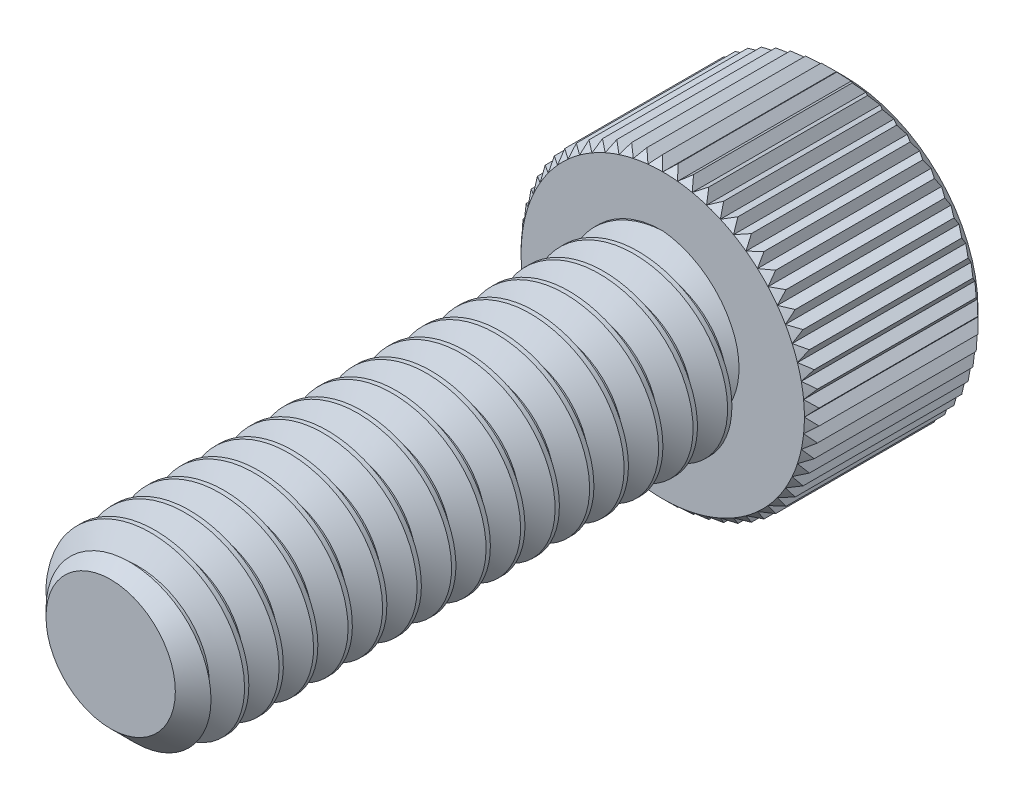
from build123d import *
from build123d.topology import SkipClean

# Parameters (mm, degrees)
SKETCH1_R          = 2.0828
EXTRUDE1_DEPTH     = 12.7
CHAMFER3_SIZE      = 0.5953125
CUT_SWEEP1_PITCH   = 0.79375
SKETCH6_R          = 3.429
EXTRUDE2_DEPTH     = 4.1656
CUT_EXTRUDE1_DEPTH = 2.67890625
CHAMFER1_SIZE      = 0.3429
CHAMFER2_SIZE      = 0.17145
CUT_EXTRUDE3_DEPTH = 14.594340166
CIRPATTERN1_COUNT  = 60


with BuildPart() as part:
    # Sketch1 → Extrude1 (new body)
    with BuildSketch(Plane.XY):
        Circle(SKETCH1_R)
    extrude(amount=-EXTRUDE1_DEPTH)

    # Chamfer3
    chamfer3_edges = [part.edges().sort_by_distance(p)[0] for p in [
        (-2.0828, 0, 0),
    ]]
    chamfer(chamfer3_edges, length=CHAMFER3_SIZE)

    # Cut-Sweep1: the profile of Sketch3 profile screwed along a right-hand helix of 17 turns, 6 arcs to a turn; built about Z, then put on its axis
    cut_sweep1_z = Axis((0, 0, 0), (0, 0, 1))
    cut_sweep1_corners = [(2.0831, 0, -0.694704455), (1.567244252, 0, -0.396875), (1.567244252, 0, -0.29765625), (2.0831, 0, 0.000173205)]
    with BuildLine(mode=Mode.PRIVATE) as cut_sweep1_profile:
        Line(cut_sweep1_corners[0], cut_sweep1_corners[1])
        Line(cut_sweep1_corners[1], cut_sweep1_corners[2])
        Line(cut_sweep1_corners[2], cut_sweep1_corners[3])
        Line(cut_sweep1_corners[3], cut_sweep1_corners[0])
    cut_sweep1_cap = Face(cut_sweep1_profile.wire())
    cut_sweep1_turn_angles = [0, 30, 60, 90, 120, 150, 180, 210, 240, 270, 300, 330, 360]
    cut_sweep1_turn_weights = [1, 0.8660254037844387, 1, 0.8660254037844387, 1, 0.8660254037844387, 1, 0.8660254037844387, 1, 0.8660254037844387, 1, 0.8660254037844387, 1]
    cut_sweep1_turn_rails = [Edge.make_bspline([Vector(p[0], p[1], 0).rotate(cut_sweep1_z, cut_sweep1_turn_angles[k]) / cut_sweep1_turn_weights[k] + Vector(0, 0, p[2] + CUT_SWEEP1_PITCH * cut_sweep1_turn_angles[k] / 360) for k in range(13)], [0, 0, 0, 1, 1, 2, 2, 3, 3, 4, 4, 5, 5, 6, 6, 6], 2, cut_sweep1_turn_weights) for p in cut_sweep1_corners]
    cut_sweep1_turn_sides = [Face.make_surface_from_curves(cut_sweep1_turn_rails[p[0]], cut_sweep1_turn_rails[p[1]]) for p in [(0, 1), (1, 2), (2, 3), (3, 0)]]
    cut_sweep1 = Plane(origin=(0, 0, 0), x_dir=(0, 1, 0), z_dir=(0, 0, -1)) * Solid(Shell([*[p.moved(Location((0, 0, CUT_SWEEP1_PITCH * i))) for i in range(17) for p in cut_sweep1_turn_sides], cut_sweep1_cap, cut_sweep1_cap.rotate(cut_sweep1_z, 6120).moved(Location((0, 0, CUT_SWEEP1_PITCH * 6120 / 360)))]))
    add(cut_sweep1, mode=Mode.SUBTRACT)

    # Sketch6 → Extrude2 (add)
    with BuildSketch(Plane(origin=(0, 0, -12.7), x_dir=(-1, 0, 0), z_dir=(0, 0, -1))):
        Circle(SKETCH6_R)
    extrude(amount=EXTRUDE2_DEPTH)

    # Sketch7 → Cut-Extrude1 (cut)
    with BuildSketch(Plane(origin=(0, 0, -16.8656), x_dir=(-1, 0, 0), z_dir=(0, 0, -1))):
        Polygon((0, 2.062222993), (-1.7859375, 1.031111496), (-1.7859375, -1.031111496), (0, -2.062222993), (1.7859375, -1.031111496), (1.7859375, 1.031111496), align=None)
    extrude(amount=-CUT_EXTRUDE1_DEPTH, mode=Mode.SUBTRACT)

    # Cut-Extrude2 cone 1 section (through the dimple's axis) → Cut-Extrude2 (revolve, cut)
    with BuildSketch(Plane(origin=(0, 0, -16.8656), x_dir=(0, 1, 0), z_dir=(1, 0, 0))):
        Polygon((0, 0), (2.062222993, 0), (0, 2.062222993), align=None)
    revolve(axis=Axis((0, 0, -16.8656), (0, 0, 1)), mode=Mode.SUBTRACT)

    # Chamfer1
    chamfer1_edges = [part.edges().sort_by_distance(p)[0] for p in [
        (3.429, 0, -16.8656),
    ]]
    chamfer(chamfer1_edges, length=CHAMFER1_SIZE)

    # Chamfer2
    chamfer2_edges = [part.edges().sort_by_distance(p)[0] for p in [
        (3.429, 0, -12.7),
    ]]
    chamfer(chamfer2_edges, length=CHAMFER2_SIZE)

    # Sketch10 → Cut-Extrude3 (cut, through all)
    with SkipClean():  # the faces are left unmerged after this step: merging them gives an invalid solid
        with BuildSketch(Plane.XY.offset(-12.7)):
            Polygon((-0.36903498, 3.60045), (0, 3.25755), (0.36903498, 3.60045), align=None)
        cut_extrude3 = extrude(amount=-CUT_EXTRUDE3_DEPTH, mode=Mode.SUBTRACT)

    # CirPattern1: Cut-Extrude3 ×60 about axis
    cirpattern1_axis = Axis((0, 0, 0), (0, 0, 1))
    for i in range(1, CIRPATTERN1_COUNT):
        add(cut_extrude3.rotate(cirpattern1_axis, i * 360 / CIRPATTERN1_COUNT), mode=Mode.SUBTRACT)


solid = part.part
